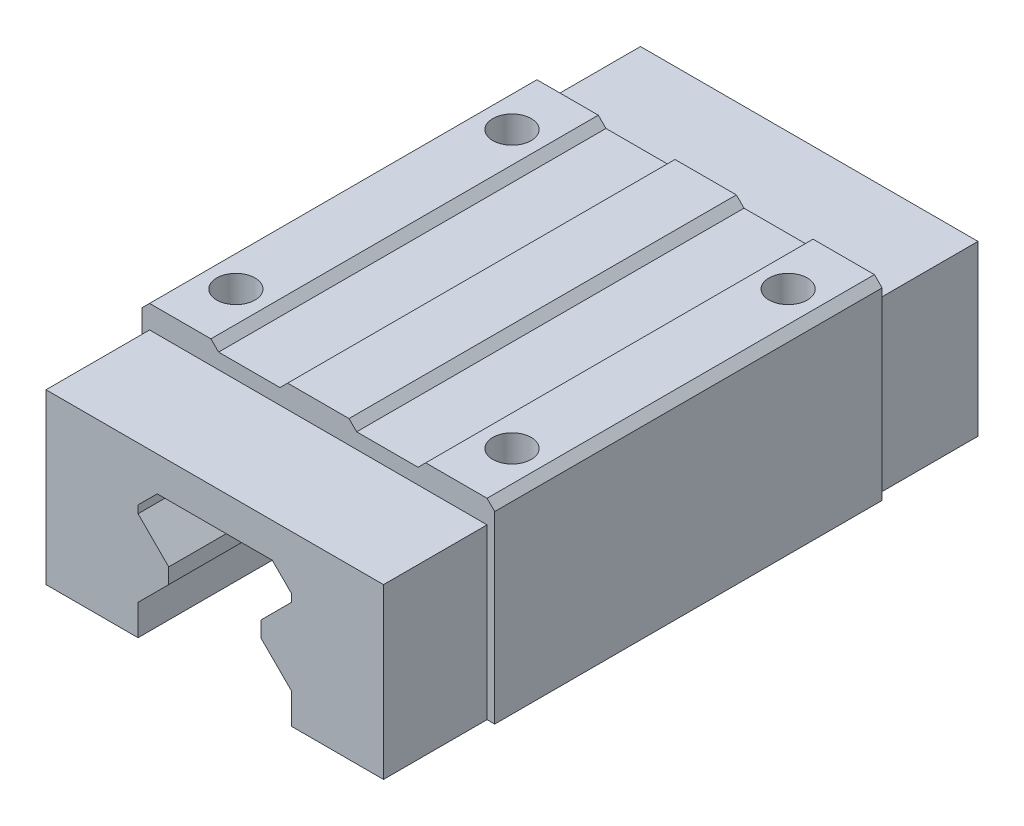
from build123d import *

# Parameters (mm, degrees)
DODANIE_WYCI_GNI_CIE1_DEPTH    = 77.5
SZKIC2_W                       = 46
SZKIC2_H                       = 50.5
DODANIE_WYCI_GNI_CIE2_DEPTH    = 3
SZKIC3_W                       = 1
SZKIC3_H                       = 50.5
DODANIE_WYCI_GNI_CIE3_DEPTH    = 22
SZKIC4_W                       = 8
SZKIC4_H                       = 50.5
WYTNIJ_WYCI_GNI_CIE1_DEPTH     = 1
SFAZOWANIE1_SIZE               = 1
OTWORY_USTALAJ_CE_5_0MM1_D     = 5
OTWORY_USTALAJ_CE_5_0MM1_DEPTH = 10
OTWORY_USTALAJ_CE_5_0MM1_TIP   = 1.502151548


with BuildPart() as part:
    # Szkic1 → Dodanie-wyciągnięcie1 (new body)
    with BuildSketch(Plane.XY):
        Polygon((-10, 0), (-10, 4), (-6, 8), (-6, 10), (-10, 14), (-10, 15), (-7.5, 17.5), (7.5, 17.5), (10, 15), (10, 14), (6, 10), (6, 8), (10, 4), (10, 0), (22, 0), (22, 22), (-22, 22), (-22, 0), align=None)
    extrude(amount=DODANIE_WYCI_GNI_CIE1_DEPTH)

    # Szkic2 → Dodanie-wyciągnięcie2 (add)
    with BuildSketch(Plane(origin=(0, 22, 0), x_dir=(1, 0, 0), z_dir=(0, 1, 0))):
        with Locations((0, -38.75)):
            Rectangle(SZKIC2_W, SZKIC2_H)
    extrude(amount=DODANIE_WYCI_GNI_CIE2_DEPTH)

    # Szkic3 → Dodanie-wyciągnięcie3 (add)
    with BuildSketch(Plane.XZ.offset(-22)):
        with Locations((-22.5, 38.75)):
            Rectangle(SZKIC3_W, SZKIC3_H)
        with Locations((22.5, 38.75)):
            Rectangle(SZKIC3_W, SZKIC3_H)
    extrude(amount=DODANIE_WYCI_GNI_CIE3_DEPTH)

    # Szkic4 → Wytnij-wyciągnięcie1 (cut)
    with BuildSketch(Plane(origin=(0, 25, 0), x_dir=(1, 0, 0), z_dir=(0, 1, 0))):
        with Locations((-9, -38.75)):
            Rectangle(SZKIC4_W, SZKIC4_H)
        with Locations((9, -38.75)):
            Rectangle(SZKIC4_W, SZKIC4_H)
    extrude(amount=-WYTNIJ_WYCI_GNI_CIE1_DEPTH, mode=Mode.SUBTRACT)

    # Sfazowanie1
    sfazowanie1_edges = [part.edges().sort_by_distance(p)[0] for p in [
        (-23, 25, 38.75),
        (-13, 25, 38.75),
        (-5, 25, 38.75),
        (5, 25, 38.75),
        (13, 25, 38.75),
        (23, 25, 38.75),
    ]]
    chamfer(sfazowanie1_edges, length=SFAZOWANIE1_SIZE - 0.0001)  # a hair under: the kernel refuses the full size

    # Otwory ustalające Ø5.0mm1
    with Locations(Plane(origin=(0, 25, 0), x_dir=(1, 0, 0), z_dir=(0, 1, 0))):
        with Locations((-18, -20.75), (18, -20.75), (18, -56.75), (-18, -56.75)):
            Hole(OTWORY_USTALAJ_CE_5_0MM1_D / 2, depth=OTWORY_USTALAJ_CE_5_0MM1_DEPTH)
            with Locations((0, 0, -(OTWORY_USTALAJ_CE_5_0MM1_DEPTH + OTWORY_USTALAJ_CE_5_0MM1_TIP / 2))):  # 118° drill point
                Cone(0, OTWORY_USTALAJ_CE_5_0MM1_D / 2, OTWORY_USTALAJ_CE_5_0MM1_TIP, mode=Mode.SUBTRACT)


solid = part.part
